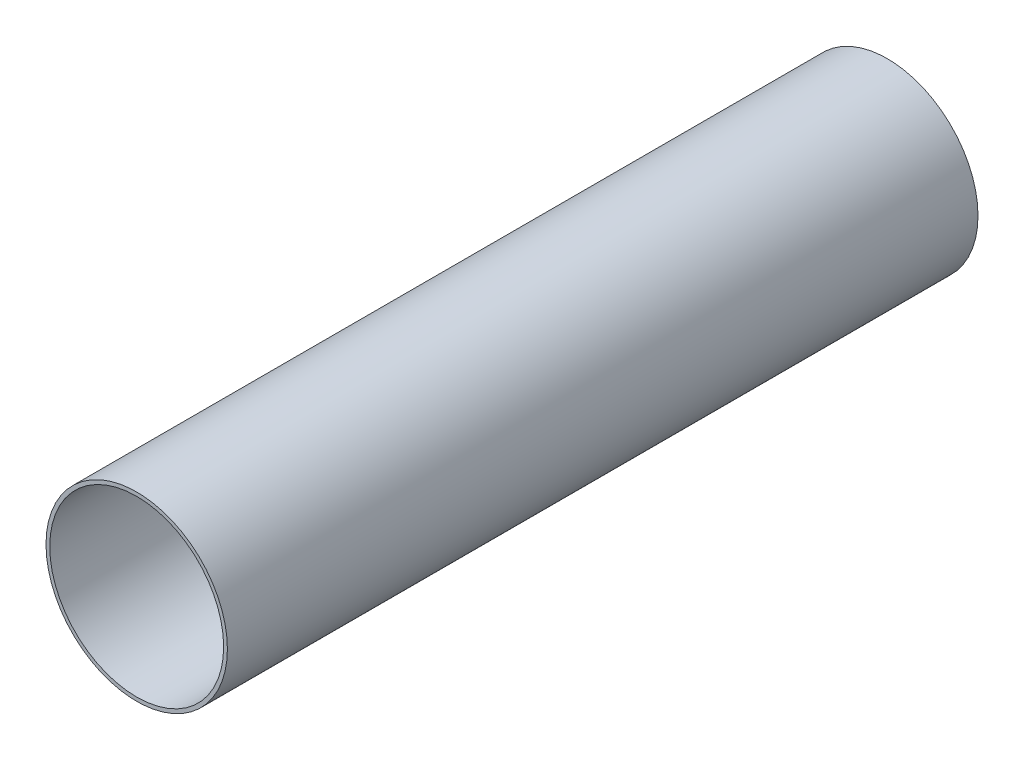
from build123d import *

# Parameters (mm, degrees)
SKETCH_1_R      = 14.5
SKETCH_1_R_2    = 13.9
EXTRUDE_1_DEPTH = 120


with BuildPart() as part:
    # 草图1 → 凸台-拉伸1 (new body)
    with BuildSketch(Plane.XY):
        Circle(SKETCH_1_R)
        Circle(SKETCH_1_R_2, mode=Mode.SUBTRACT)
    extrude(amount=EXTRUDE_1_DEPTH)


solid = part.part
